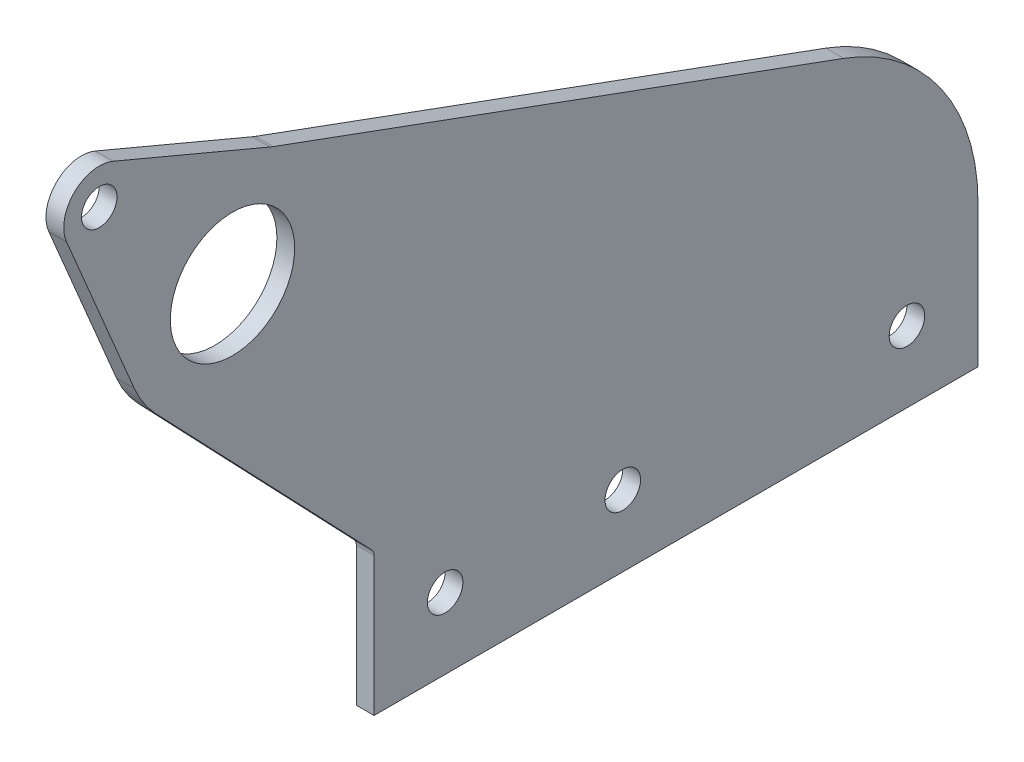
from build123d import *

# Parameters (mm, degrees)
SKETCH1_R          = 11.1125
BASE_FLANGE1_DEPTH = 3.175
SKETCH2_R          = 3.175
TAB1_DEPTH         = 3.175
SKETCH3_R          = 3.175
CUT_EXTRUDE1_DEPTH = 209.903242457
FILLET1_R          = 1.5875


# Sheet-metal steps are written as plain solids
with BuildPart() as part:
    # Sketch1 → Base-Flange1 (new body)
    with BuildSketch(Plane(origin=(0, 0, 0), x_dir=(0, 0, -1), z_dir=(1, 0, 0))):
        with BuildLine():
            Line((0, 0), (0, 25.4))
            Line((0, 25.4), (-39.085182146, 66.301387632))
            ThreePointArc((-39.085182146, 66.301387632), (-41.252321544, 89.894394258), (-18.764209654, 97.351691251))
            Line((-18.764209654, 97.351691251), (177.8, 25.4))
            Line((177.8, 25.4), (177.8, 0))
            Line((177.8, 0), (0, 0))
        make_face()
        with Locations((-25.3124843, 79.462515777)):
            Circle(SKETCH1_R, mode=Mode.SUBTRACT)
    extrude(amount=-BASE_FLANGE1_DEPTH)

    # Sketch2 → Tab1 (add)
    with BuildSketch(Plane(origin=(0, 0, 0), x_dir=(0, 0, -1), z_dir=(1, 0, 0))):
        with BuildLine():
            Line((-46.659727461, 109.126939283), (-18.616317191, 97.313010257))
            ThreePointArc((-18.616317191, 97.313010257), (-18.335147008, 97.198498454), (-18.051319944, 97.090740286))
            Line((-18.051319944, 97.090740286), (-18.764209654, 97.351691251))
            ThreePointArc((-18.764209654, 97.351691251), (-39.101007237, 92.607063514), (-42.868254817, 72.06674526))
            Line((-42.868254817, 72.06674526), (-54.976907806, 100.809758938))
            ThreePointArc((-54.976907806, 100.809758938), (-53.615112361, 107.765143837), (-46.659727461, 109.126939283))
        make_face()
        with Locations((-49.1249843, 103.275015777)):
            Circle(SKETCH2_R, mode=Mode.SUBTRACT)
    extrude(amount=-TAB1_DEPTH)

    # Sketch3 → Cut-Extrude1 (cut, through all)
    with BuildSketch(Plane.ZY.offset(3.175)):
        with Locations((-95.25, 12.7)):
            Circle(SKETCH3_R)
        with Locations((-12.7, 12.7)):
            Circle(SKETCH3_R)
        with Locations((-44.45, 12.7)):
            Circle(SKETCH3_R)
        with BuildLine():
            Line((-107.95, 25.4), (-107.95, 0))
            Line((-107.95, 0), (-177.8, 0))
            Line((-177.8, 0), (-177.8, 25.4))
            Line((-177.8, 25.4), (-83.93965963, 59.757273091))
            ThreePointArc((-83.93965963, 59.757273091), (-101.35258254, 46.357806773), (-107.95, 25.4))
        make_face()
    extrude(amount=-CUT_EXTRUDE1_DEPTH, mode=Mode.SUBTRACT)

    # Fillet1
    fillet1_edges = [part.edges().sort_by_distance(p)[0] for p in [
        (-1.5875, 25.4, 0),
    ]]
    fillet(fillet1_edges, radius=FILLET1_R)


solid = part.part
